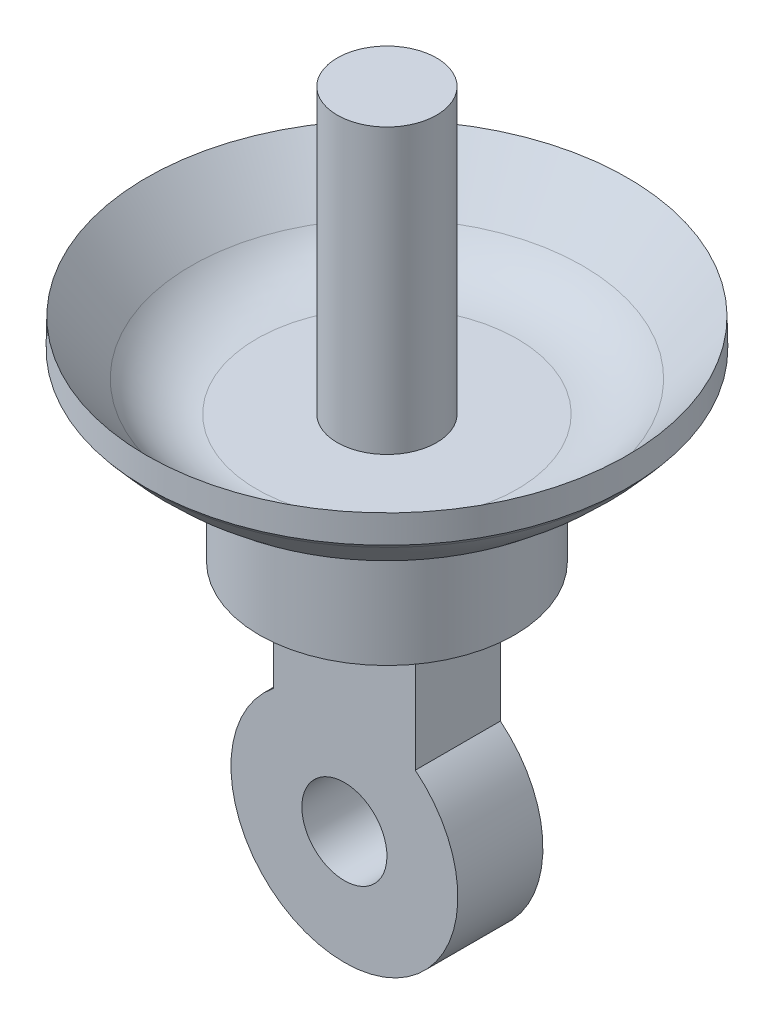
from build123d import *

# Parameters (mm, degrees)
ESBO_O1_R                     = 7.5
RESSALTO_EXTRUS_O1_DEPTH      = 8
ESBO_O2_R                     = 8.5
RESSALTO_EXTRUS_O2_DEPTH      = 3
ESBO_O3_W                     = 8
ESBO_O3_H                     = 3
RESSALTO_EXTRUS_O3_DEPTH      = 10
CORTE_EXTRUS_O1_DEPTH         = 23.27666941
CORTE_EXTRUS_O1_DEPTH_BACK    = 23.27666941
ESBO_O5_R                     = 3
CORTE_EXTRUS_O2_DEPTH         = 3
ESBO_O6_R                     = 5.5
RESSALTO_EXTRUS_O4_DEPTH      = 10
FILETE1_R                     = 1
ESBO_O8_R                     = 1.75
RESSALTO_EXTRUS_O5_DEPTH      = 10
ESBO_O10_R                    = 4.5
RESSALTO_EXTRUS_O6_DEPTH      = 3.5
ESBO_O11_W                    = 5
ESBO_O11_H                    = 3
RESSALTO_EXTRUS_O7_DEPTH      = 5
RESSALTO_EXTRUS_O8_DEPTH      = 1.5
RESSALTO_EXTRUS_O8_DEPTH_BACK = 1.5
ESBO_O13_R                    = 4
ESBO_O14_R                    = 2.5
CORTE_EXTRUS_O3_DEPTH         = 10
FILETE2_R                     = 10
FILETE3_R                     = 3
CUT_EXTRUDE2_START            = -24
CUT_EXTRUDE2_OUTLINE_R        = 8.5
CUT_EXTRUDE2_DEPTH            = 43
SKETCH2_R                     = 2.5
SKETCH2_R_2                   = 1.5
BOSS_EXTRUDE1_DEPTH           = 3


with BuildPart() as part:
    # Esboço1 → Ressalto-extrusão1 (new body)
    with BuildSketch(Plane(origin=(0, 0, 0), x_dir=(1, 0, 0), z_dir=(0, 1, 0))):
        with Locations(Location((0, 0, 0), (0, 0, 270))):
            Circle(ESBO_O1_R)
    extrude(amount=RESSALTO_EXTRUS_O1_DEPTH)

    # Esboço2 → Ressalto-extrusão2 (add)
    with BuildSketch(Plane.XZ):
        with Locations(Location((0, 0, 0), (0, 0, 270))):
            Circle(ESBO_O2_R)
    extrude(amount=RESSALTO_EXTRUS_O2_DEPTH)

    # Esboço3 → Ressalto-extrusão3 (add)
    with BuildSketch(Plane(origin=(0, 8, 0), x_dir=(1, 0, 0), z_dir=(0, 1, 0))):
        Rectangle(ESBO_O3_W, ESBO_O3_H)
    extrude(amount=RESSALTO_EXTRUS_O3_DEPTH)

    # Esboço4 → Corte-extrusão1 (cut, two sides: drawn at the far end of the back side and taken through both)
    with BuildSketch(Plane.XY.offset(1.5).offset(-CORTE_EXTRUS_O1_DEPTH_BACK)):
        with BuildLine():
            Line((-4, 18), (-4, 13.999999871))
            ThreePointArc((-4, 13.999999871), (-2.828427176, 16.828427073), (-1.7e-08, 18))
            Line((-1.7e-08, 18), (-4, 18))
        make_face()
        with BuildLine():
            Line((4, 18), (-1.7e-08, 18))
            ThreePointArc((-1.7e-08, 18), (2.828427119, 16.828427131), (4, 14))
            Line((4, 14), (4, 18))
        make_face()
    extrude(amount=CORTE_EXTRUS_O1_DEPTH + CORTE_EXTRUS_O1_DEPTH_BACK, mode=Mode.SUBTRACT)

    # Esboço5 → Corte-extrusão2 (cut)
    with BuildSketch(Plane.XY.offset(1.5)):
        with Locations((0, 14)):
            Circle(ESBO_O5_R)
    extrude(amount=-CORTE_EXTRUS_O2_DEPTH, mode=Mode.SUBTRACT)

    # Esboço6 → Ressalto-extrusão4 (add)
    with BuildSketch(Plane.XZ.offset(3)):
        with Locations(Location((0, 0, 0), (0, 0, 270))):
            Circle(ESBO_O6_R)
    extrude(amount=RESSALTO_EXTRUS_O4_DEPTH)

    # Loft1: read off the stored shape, not the designer's step
    # Loft1: loft between two sections, ruled curve by curve
    loft1_from = [
        Edge.make_bspline([(1.054348973, -13, 5.397994835), (-9.741640698, -13, 7.506692781), (-11.850338644, -13, -3.28929689), (-1.054348973, -13, -5.397994835), (9.741640698, -13, -7.506692781), (11.850338644, -13, 3.28929689), (1.054348973, -13, 5.397994835)], [0, 0, 0, 0, 0.5, 0.5, 0.5, 1, 1, 1, 1], 3, [1, 0.333333333, 0.333333333, 1, 0.333333333, 0.333333333, 1]),
    ]
    loft1_to = [
        Edge.make_bspline([(-0.660465845, -24, 3.945096307), (-8.550658458, -24, 2.624164617), (-7.229726768, -24, -5.266027996), (0.660465845, -24, -3.945096307), (8.550658458, -24, -2.624164617), (7.229726768, -24, 5.266027996), (-0.660465845, -24, 3.945096307)], [0, 0, 0, 0, 0.5, 0.5, 0.5, 1, 1, 1, 1], 3, [1, 0.333333333, 0.333333333, 1, 0.333333333, 0.333333333, 1]),
    ]
    loft1 = Solid(Shell([*[Face.make_surface_from_curves(loft1_from[k], loft1_to[k]) for k in range(1)], Face(Wire(loft1_from)), Face(Wire(loft1_to))]))
    add(loft1)

    # Filete1
    filete1_edges = [part.edges().sort_by_distance(p)[0] for p in [
        (-5.474439314, -13, 0.529635915),
    ]]
    fillet(filete1_edges, radius=FILETE1_R)

    # Esboço8 → Ressalto-extrusão5 (add)
    with BuildSketch(Plane.XZ.offset(24)):
        with Locations(Location((0, 0, 0), (0, 0, 270))):
            Circle(ESBO_O8_R)
    extrude(amount=RESSALTO_EXTRUS_O5_DEPTH)

    # Esboço9 → Revolução1 (revolve)
    with BuildSketch(Plane(origin=(0, 0, 0), x_dir=(0, 0, -1), z_dir=(1, 0, 0)), mode=Mode.PRIVATE) as revolu_o1_sk:
        Polygon((0, -34), (6, -34), (8.480200039, -31.023759953), (8.5, -32), (6, -35), (0, -35), align=None)
    revolve(revolu_o1_sk.sketch.rotate(Axis((0, 0, 0), (0, -1, 0)), 180), axis=Axis((0, 0, 0), (0, -1, 0)))

    # Esboço10 → Ressalto-extrusão6 (add)
    with BuildSketch(Plane.XZ.offset(35)):
        with Locations(Location((0, 0, 0), (0, 0, 90))):
            Circle(ESBO_O10_R)
    extrude(amount=RESSALTO_EXTRUS_O6_DEPTH)

    # Esboço11 → Ressalto-extrusão7 (add)
    with BuildSketch(Plane.XZ.offset(38.5)):
        Rectangle(ESBO_O11_W, ESBO_O11_H)
    extrude(amount=RESSALTO_EXTRUS_O7_DEPTH)

    # Esboço13 → Ressalto-extrusão8 (add, two sides: drawn at the far end of the back side and taken through both)
    with BuildSketch(Plane.XY.offset(-RESSALTO_EXTRUS_O8_DEPTH_BACK)):
        with Locations((0.000453955, -45.999999998)):
            Circle(ESBO_O13_R)
    extrude(amount=RESSALTO_EXTRUS_O8_DEPTH + RESSALTO_EXTRUS_O8_DEPTH_BACK)

    # Esboço14 → Corte-extrusão3 (cut)
    with BuildSketch(Plane(origin=(0, 0, -1.5), x_dir=(-1, 0, 0), z_dir=(0, 0, -1))):
        with Locations((-0.000453955, -45.999999998)):
            Circle(ESBO_O14_R)
    extrude(amount=-CORTE_EXTRUS_O3_DEPTH, mode=Mode.SUBTRACT)

    # Filete2
    # the kernel refuses this fillet: 10 mm, written as the material it takes off along each edge
    with BuildSketch(Plane(origin=(0, -35, 0), x_dir=(0, 0, 1), z_dir=(1, 0, 0))) as filete2_piece_1:
        with BuildLine():
            CenterArc((0.686510113, -9.244311488), FILETE2_R, 39.805571092, 27.777161729)
            Line((4.5, 0), (6, 0))
            Line((6, 0), (8.368722909, -2.842467491))
        make_face()
    revolve(axis=Axis((0, -35, 0), (0, -1, 0)), mode=Mode.SUBTRACT)

    # Filete3
    filete3_edges = [part.edges().sort_by_distance(p)[0] for p in [
        (0, -34, -6),
    ]]
    fillet(filete3_edges, radius=FILETE3_R)

    # Cut-Extrude2: read off the stored shape, not the designer's step
    # Cut-Extrude2 outline → Cut-Extrude2 (cut)
    with BuildSketch(Plane(origin=(0, 0, 0), x_dir=(1, 0, 0), z_dir=(0, 1, 0)).offset(CUT_EXTRUDE2_START)):
        Circle(CUT_EXTRUDE2_OUTLINE_R)
    extrude(amount=CUT_EXTRUDE2_DEPTH, mode=Mode.SUBTRACT)

    # Sketch2 → Boss-Extrude1 (add)
    with BuildSketch(Plane(origin=(0, 0, -1.5), x_dir=(-1, 0, 0), z_dir=(0, 0, -1))):
        with Locations((-0.000453955, -45.999999998)):
            Circle(SKETCH2_R)
        with Locations(Location((-0.000453955, -45.999999998, 0), (0, 0, 90))):
            Circle(SKETCH2_R_2, mode=Mode.SUBTRACT)
    extrude(amount=-BOSS_EXTRUDE1_DEPTH)


solid = part.part
